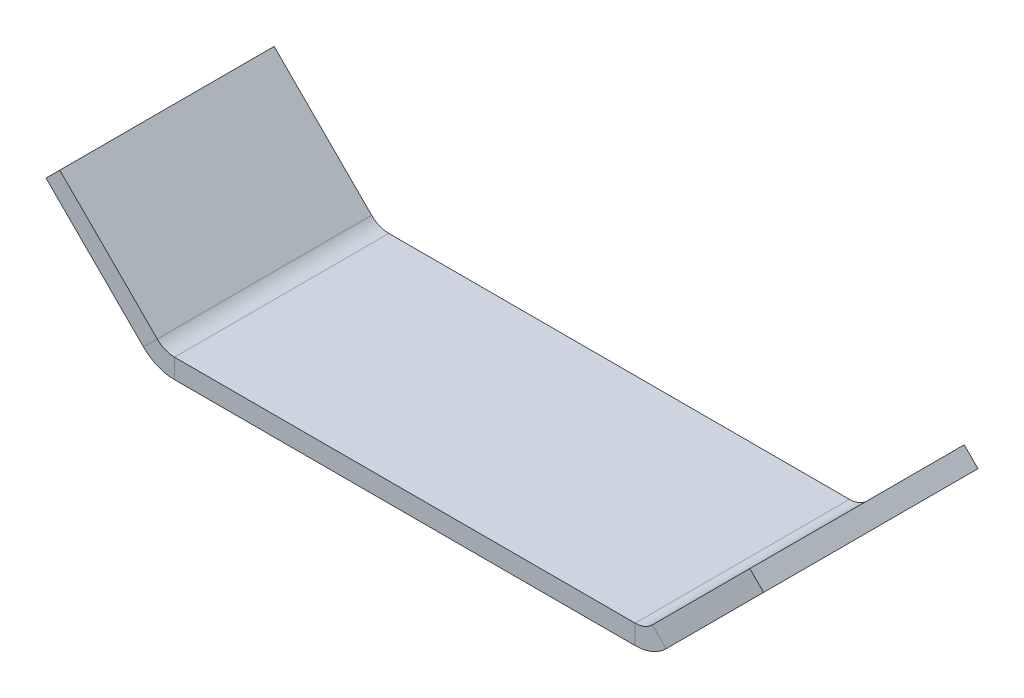
from build123d import *

# Parameters (mm, degrees)
BASE_FLANGE1_DEPTH = 11.176


# Sheet-metal steps are written as plain solids
with BuildPart() as part:
    # Sketch1 → Base-Flange1 (new body)
    with BuildSketch(Plane.XY):
        with BuildLine():
            Line((-17.987822374, 5.453754656), (-12.906042106, 0.371974388))
            ThreePointArc((-12.906042106, 0.371974388), (-12.494024453, 0.096672994), (-12.008016494, 0))
            Line((-12.008016494, 0), (12.008016494, 0))
            ThreePointArc((12.008016494, 0), (12.494024453, 0.096672994), (12.906042106, 0.371974388))
            Line((12.906042106, 0.371974388), (17.987822374, 5.453754656))
            Line((17.987822374, 5.453754656), (18.706242864, 4.735334166))
            Line((18.706242864, 4.735334166), (13.624462596, -0.346446102))
            ThreePointArc((13.624462596, -0.346446102), (12.88283082, -0.841988611), (12.008016494, -1.016))
            Line((12.008016494, -1.016), (-12.008016494, -1.016))
            ThreePointArc((-12.008016494, -1.016), (-12.88283082, -0.841988611), (-13.624462596, -0.346446102))
            Line((-13.624462596, -0.346446102), (-18.706242864, 4.735334166))
            Line((-18.706242864, 4.735334166), (-17.987822374, 5.453754656))
        make_face()
    extrude(amount=BASE_FLANGE1_DEPTH)


solid = part.part
